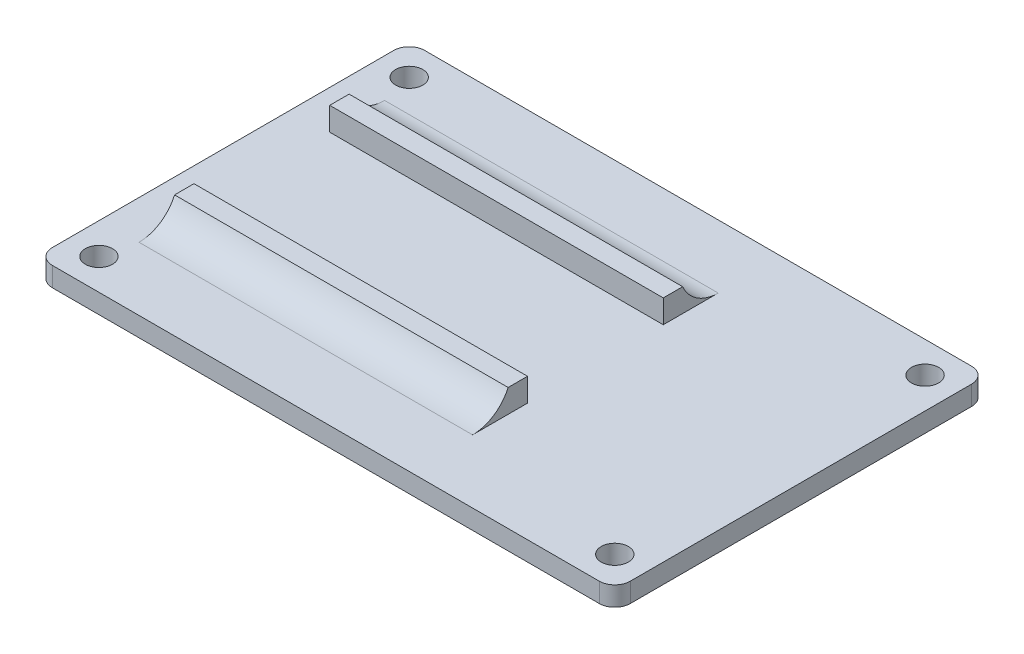
from build123d import *

# Parameters (mm, degrees)
SKETCH1_R           = 1.75
BOSS_EXTRUDE1_DEPTH = 2.5
SKETCH2_W           = 43
SKETCH2_H           = 2.5
BOSS_EXTRUDE2_DEPTH = 3
FILLET1_R           = 5


with BuildPart() as part:
    # Sketch1 → Boss-Extrude1 (new body)
    with BuildSketch(Plane(origin=(0, 0, 0), x_dir=(1, 0, 0), z_dir=(0, 1, 0))):
        with BuildLine():
            Line((-52.476274799, 21.3340289), (18.023725201, 21.3340289))
            ThreePointArc((18.023725201, 21.3340289), (19.437938764, 20.748242463), (20.023725201, 19.3340289))
            Line((20.023725201, 19.3340289), (20.023725201, -24.6659711))
            ThreePointArc((20.023725201, -24.6659711), (19.437938764, -26.080184662), (18.023725201, -26.6659711))
            Line((18.023725201, -26.6659711), (-52.476274799, -26.6659711))
            ThreePointArc((-52.476274799, -26.6659711), (-53.890488361, -26.080184662), (-54.476274799, -24.6659711))
            Line((-54.476274799, -24.6659711), (-54.476274799, 19.3340289))
            ThreePointArc((-54.476274799, 19.3340289), (-53.890488361, 20.748242463), (-52.476274799, 21.3340289))
        make_face()
        with Locations(Location((-50.476274799, 17.3340289, 0), (0, 0, 270))):
            Circle(SKETCH1_R, mode=Mode.SUBTRACT)
        with Locations(Location((16.023725201, 17.3340289, 0), (0, 0, 270))):
            Circle(SKETCH1_R, mode=Mode.SUBTRACT)
        with Locations(Location((16.023725201, -22.6659711, 0), (0, 0, 270))):
            Circle(SKETCH1_R, mode=Mode.SUBTRACT)
        with Locations(Location((-50.476274799, -22.6659711, 0), (0, 0, 270))):
            Circle(SKETCH1_R, mode=Mode.SUBTRACT)
    extrude(amount=BOSS_EXTRUDE1_DEPTH)

    # Sketch2 → Boss-Extrude2 (add)
    with BuildSketch(Plane(origin=(0, 2.5, 0), x_dir=(1, 0, 0), z_dir=(0, 1, 0))):
        with Locations((-27.976274799, 7.3340289)):
            Rectangle(SKETCH2_W, SKETCH2_H)
        with Locations((-27.976274799, -12.6659711)):
            Rectangle(SKETCH2_W, SKETCH2_H)
    extrude(amount=BOSS_EXTRUDE2_DEPTH)

    # Fillet1
    # the kernel refuses this fillet: 5 mm, written as the material it adds along each edge
    with BuildSketch(Plane(origin=(-49.476274799, 2.5, -8.5840289), x_dir=(0, 0, -1), z_dir=(1, 0, 0)), Plane(origin=(-6.476274799, 2.5, 13.9159711), x_dir=(0, 0, 1), z_dir=(-1, 0, 0))) as fillet1_piece_1:
        with BuildLine():
            CenterArc((4.582575695, 5), FILLET1_R, 203.578178478, 66.421821522)
            Line((0, 3), (-0.091651514, 2.96))
            ThreePointArc((-0.091651514, 2.96), (-0.1, 1.5), (-0.1, 0))
            Line((-0.1, 0), (0, -0.1))
            Line((0, -0.1), (4.582575695, -0.1))
            Line((4.582575695, -0.1), (4.582575695, 0))
        make_face()
    extrude(amount=43)


solid = part.part
